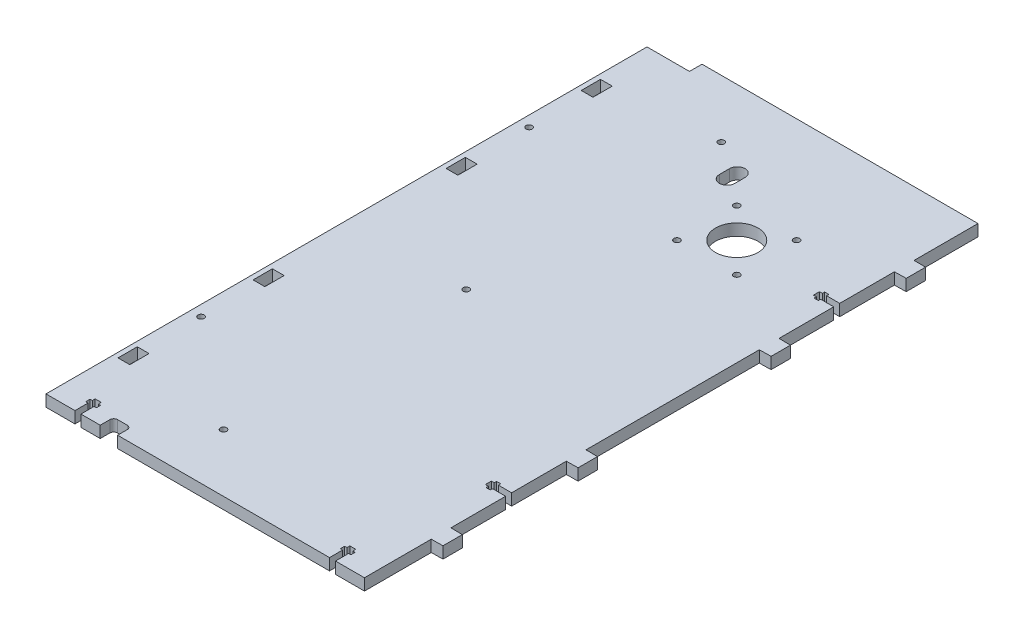
from build123d import *

# Parameters (mm, degrees)
SKETCH_1_R      = 1.6
SKETCH_1_R_2    = 11
SKETCH_1_W      = 6.1
SKETCH_1_H      = 10
EXTRUDE_1_DEPTH = 6


with BuildPart() as part:
    # Эскиз1 → Бобышка-Вытянуть1 (new body)
    with BuildSketch(Plane(origin=(0, 0, 6), x_dir=(1, 0, 0), z_dir=(0, 1, 0))):
        with BuildLine():
            Line((933.155518961, 517.721066), (933.155518961, 552.32339))
            Line((933.155518961, 552.32339), (939.155518961, 552.42339))
            Line((939.155518961, 552.42339), (939.155518961, 562.42339))
            Line((939.155518961, 562.42339), (933.155518961, 562.52339))
            Line((933.155518961, 562.52339), (933.155518961, 590.87339))
            Line((933.155518961, 590.87339), (926.355518961, 590.87339))
            Line((926.355518961, 590.87339), (926.355518961, 589.67339))
            Line((926.355518961, 589.67339), (924.155518961, 589.67339))
            Line((924.155518961, 589.67339), (924.155518961, 590.87339))
            Line((924.155518961, 590.87339), (922.655518961, 590.87339))
            Line((922.655518961, 590.87339), (922.655518961, 593.97339))
            Line((922.655518961, 593.97339), (924.155518961, 593.97339))
            Line((924.155518961, 593.97339), (924.155518961, 595.17339))
            Line((924.155518961, 595.17339), (926.355518961, 595.17339))
            Line((926.355518961, 595.17339), (926.355518961, 593.97339))
            Line((926.355518961, 593.97339), (933.155518961, 593.97339))
            Line((933.155518961, 593.97339), (933.155518961, 622.32339))
            Line((933.155518961, 622.32339), (939.155518961, 622.42339))
            Line((939.155518961, 622.42339), (939.155518961, 632.42339))
            Line((939.155518961, 632.42339), (933.155518961, 632.52339))
            Line((933.155518961, 632.52339), (933.155518961, 722.32339))
            Line((933.155518961, 722.32339), (939.155518961, 722.42339))
            Line((939.155518961, 722.42339), (939.155518961, 732.42339))
            Line((939.155518961, 732.42339), (933.155518961, 732.52339))
            Line((933.155518961, 732.52339), (933.155518961, 760.87339))
            Line((933.155518961, 760.87339), (926.355518961, 760.87339))
            Line((926.355518961, 760.87339), (926.355518961, 759.67339))
            Line((926.355518961, 759.67339), (924.155518961, 759.67339))
            Line((924.155518961, 759.67339), (924.155518961, 760.87339))
            Line((924.155518961, 760.87339), (922.655518961, 760.87339))
            Line((922.655518961, 760.87339), (922.655518961, 763.97339))
            Line((922.655518961, 763.97339), (924.155518961, 763.97339))
            Line((924.155518961, 763.97339), (924.155518961, 765.17339))
            Line((924.155518961, 765.17339), (926.355518961, 765.17339))
            Line((926.355518961, 765.17339), (926.355518961, 763.97339))
            Line((926.355518961, 763.97339), (933.155518961, 763.97339))
            Line((933.155518961, 763.97339), (933.155518961, 792.32339))
            Line((933.155518961, 792.32339), (939.155518961, 792.42339))
            Line((939.155518961, 792.42339), (939.155518961, 802.42339))
            Line((939.155518961, 802.42339), (933.155518961, 802.52339))
            Line((933.155518961, 802.52339), (933.155518961, 835.62339))
            Line((933.155518961, 835.62339), (833.155518961, 835.62339))
            Line((833.155518961, 835.62339), (790.155518961, 835.62339))
            Line((790.155518961, 835.62339), (790.155518961, 829.12339))
            Line((790.155518961, 829.12339), (768.155518961, 829.12339))
            Line((768.155518961, 829.12339), (768.155518961, 517.721066))
            Line((768.155518961, 517.721066), (783.155518961, 517.721066))
            Line((783.155518961, 517.721066), (783.155518961, 524.521066))
            Line((783.155518961, 524.521066), (781.955518961, 524.521066))
            Line((781.955518961, 524.521066), (781.955518961, 526.721066))
            Line((781.955518961, 526.721066), (783.155518961, 526.721066))
            Line((783.155518961, 526.721066), (783.155518961, 528.221066))
            Line((783.155518961, 528.221066), (786.255518961, 528.221066))
            Line((786.255518961, 528.221066), (786.255518961, 526.721066))
            Line((786.255518961, 526.721066), (787.455518961, 526.721066))
            Line((787.455518961, 526.721066), (787.455518961, 524.521066))
            Line((787.455518961, 524.521066), (786.255518961, 524.521066))
            Line((786.255518961, 524.521066), (786.255518961, 517.721066))
            Line((786.255518961, 517.721066), (796.255518961, 517.721066))
            Line((796.255518961, 517.721066), (796.255518961, 522.721066))
            ThreePointArc((796.255518961, 522.721066), (796.841305399, 524.135279562), (798.255518961, 524.721066))
            Line((798.255518961, 524.721066), (803.255518961, 524.721066))
            ThreePointArc((803.255518961, 524.721066), (804.669732523, 524.135279562), (805.255518961, 522.721066))
            Line((805.255518961, 522.721066), (805.255518961, 517.721066))
            Line((805.255518961, 517.721066), (833.155518961, 517.721066))
            Line((833.155518961, 517.721066), (915.055518961, 517.721066))
            Line((915.055518961, 517.721066), (915.055518961, 524.521066))
            Line((915.055518961, 524.521066), (913.855518961, 524.521066))
            Line((913.855518961, 524.521066), (913.855518961, 526.721066))
            Line((913.855518961, 526.721066), (915.055518961, 526.721066))
            Line((915.055518961, 526.721066), (915.055518961, 528.221066))
            Line((915.055518961, 528.221066), (918.155518961, 528.221066))
            Line((918.155518961, 528.221066), (918.155518961, 526.721066))
            Line((918.155518961, 526.721066), (919.355518961, 526.721066))
            Line((919.355518961, 526.721066), (919.355518961, 524.521066))
            Line((919.355518961, 524.521066), (918.155518961, 524.521066))
            Line((918.155518961, 524.521066), (918.155518961, 517.721066))
            Line((918.155518961, 517.721066), (933.155518961, 517.721066))
        make_face()
        with Locations((830.155518961, 805.62339)):
            Circle(SKETCH_1_R, mode=Mode.SUBTRACT)
        with Locations((830.155518961, 673.422228)):
            Circle(SKETCH_1_R, mode=Mode.SUBTRACT)
        with Locations((830.155518961, 547.721066)):
            Circle(SKETCH_1_R, mode=Mode.SUBTRACT)
        with Locations((862.655518961, 781.12339)):
            Circle(SKETCH_1_R, mode=Mode.SUBTRACT)
        with Locations((773.705518961, 592.52339)):
            Circle(SKETCH_1_R, mode=Mode.SUBTRACT)
        with Locations((773.705518961, 762.52339)):
            Circle(SKETCH_1_R, mode=Mode.SUBTRACT)
        with Locations((862.655518961, 750.12339)):
            Circle(SKETCH_1_R, mode=Mode.SUBTRACT)
        with Locations((878.155518961, 765.62339)):
            Circle(SKETCH_1_R_2, mode=Mode.SUBTRACT)
        with Locations((893.655518961, 750.12339)):
            Circle(SKETCH_1_R, mode=Mode.SUBTRACT)
        with Locations((893.655518961, 781.12339)):
            Circle(SKETCH_1_R, mode=Mode.SUBTRACT)
        with BuildLine():
            Line((844.155518961, 795.906330479), (844.155518961, 790.62339))
            ThreePointArc((844.155518961, 790.62339), (848.155518961, 786.62339), (852.155518961, 790.62339))
            Line((852.155518961, 790.62339), (852.155518961, 795.906330479))
            ThreePointArc((852.155518961, 795.906330479), (848.155518961, 799.906330479), (844.155518961, 795.906330479))
        make_face(mode=Mode.SUBTRACT)
        with Locations((773.705518961, 557.52339)):
            Rectangle(SKETCH_1_W, SKETCH_1_H, mode=Mode.SUBTRACT)
        with Locations((773.705518961, 627.52339)):
            Rectangle(SKETCH_1_W, SKETCH_1_H, mode=Mode.SUBTRACT)
        with Locations((773.705518961, 727.52339)):
            Rectangle(SKETCH_1_W, SKETCH_1_H, mode=Mode.SUBTRACT)
        with Locations((773.705518961, 797.52339)):
            Rectangle(SKETCH_1_W, SKETCH_1_H, mode=Mode.SUBTRACT)
    extrude(amount=-EXTRUDE_1_DEPTH)


solid = part.part
